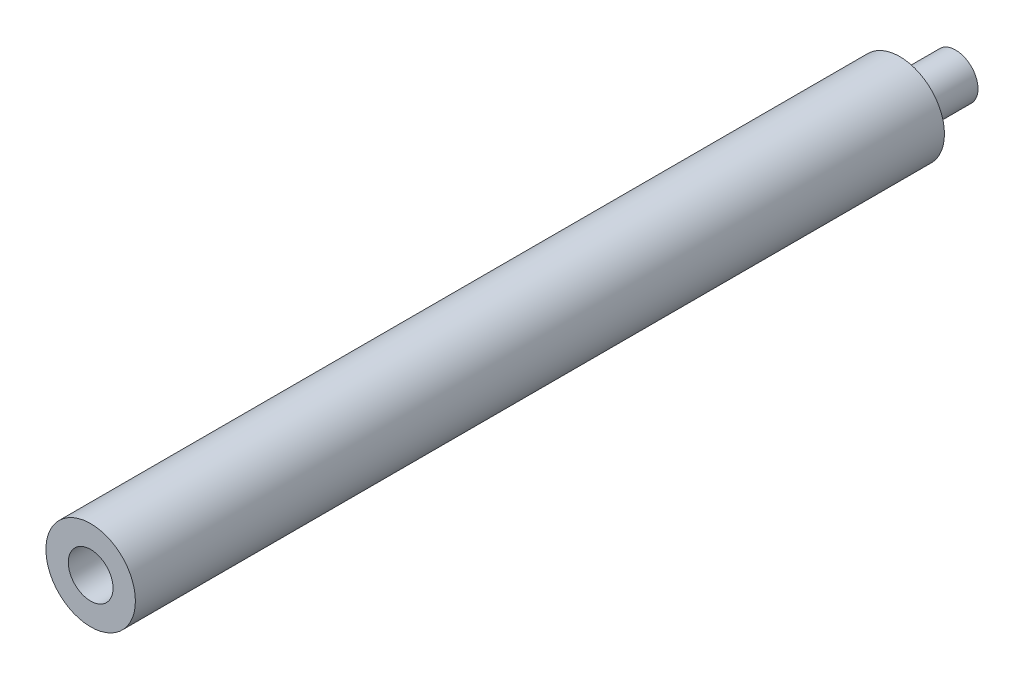
from build123d import *

# Parameters (mm, degrees)
SKETCH1_R           = 6
BOSS_EXTRUDE1_DEPTH = 54.25
SKETCH3_R           = 3
BOSS_EXTRUDE3_DEPTH = 7.5
SKETCH2_R           = 3
CUT_EXTRUDE1_DEPTH  = 5


with BuildPart() as part:
    # Sketch1 → Boss-Extrude1 (new, symmetric)
    with BuildSketch(Plane.XY):
        Circle(SKETCH1_R)
    extrude(amount=BOSS_EXTRUDE1_DEPTH, both=True)

    # Sketch3 → Boss-Extrude3 (add)
    with BuildSketch(Plane(origin=(0, 0, -54.25), x_dir=(-1, 0, 0), z_dir=(0, 0, -1))):
        Circle(SKETCH3_R)
    extrude(amount=BOSS_EXTRUDE3_DEPTH)

    # Sketch2 → Cut-Extrude1 (cut)
    with BuildSketch(Plane.XY.offset(54.25)):
        Circle(SKETCH2_R)
    extrude(amount=-CUT_EXTRUDE1_DEPTH, mode=Mode.SUBTRACT)


solid = part.part
